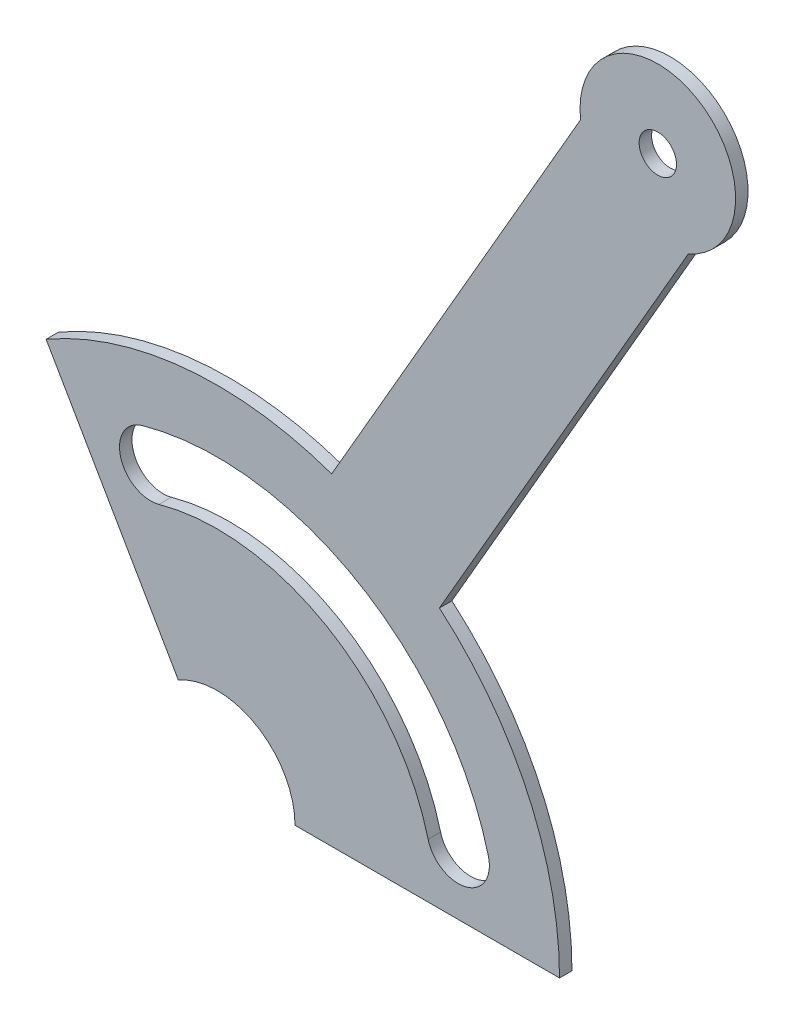
from build123d import *

# Parameters (mm, degrees)
BASE_FLANGE1_DEPTH = 2
CUT_EXTRUDE1_DEPTH = 10
SKETCH9_R          = 3
CUT_EXTRUDE2_DEPTH = 10


# Sheet-metal steps are written as plain solids
with BuildPart() as part:
    # Sketch1 → Base-Flange1 (new body)
    with BuildSketch(Plane.XY):
        with BuildLine():
            Line((12.5, 0), (55, 0))
            ThreePointArc((55, 0), (49.942986861, 23.036884846), (35.701888604, 41.837484988))
            Line((35.701888604, 41.837484988), (75.701888604, 111.119517291))
            ThreePointArc((75.701888604, 111.119517291), (77.041634566, 133.440025366), (58.381380528, 121.119517291))
            Line((58.381380528, 121.119517291), (18.381380528, 51.837484988))
            ThreePointArc((18.381380528, 51.837484988), (-5.02096593, 54.770337785), (-27.5, 47.631397208))
            Line((-27.5, 47.631397208), (-6.25, 10.825317547))
            ThreePointArc((-6.25, 10.825317547), (6.25, 10.825317547), (12.5, 0))
        make_face()
    extrude(amount=-BASE_FLANGE1_DEPTH)

    # Sketch6 → Cut-Extrude1 (cut)
    with BuildSketch(Plane(origin=(0, 0, -2), x_dir=(-1, 0, 0), z_dir=(0, 0, -1))):
        with BuildLine():
            ThreePointArc((12.04274553, 43.35864712), (-22.5, 38.97114317), (-43.571062645, 11.25))
            ThreePointArc((-43.571062645, 11.25), (-39.979833462, 5.158770817), (-33.888604279, 8.75))
            ThreePointArc((-33.888604279, 8.75), (-17.5, 30.310889132), (9.366579857, 33.723392205))
            ThreePointArc((9.366579857, 33.723392205), (15.522290151, 37.202936826), (12.04274553, 43.35864712))
        make_face()
    extrude(amount=-CUT_EXTRUDE1_DEPTH, mode=Mode.SUBTRACT)

    # Sketch9 → Cut-Extrude2 (cut)
    with BuildSketch(Plane(origin=(0, 0, -2), x_dir=(-1, 0, 0), z_dir=(0, 0, -1))):
        with Locations((-70.791634566, 122.614707819)):
            Circle(SKETCH9_R)
    extrude(amount=-CUT_EXTRUDE2_DEPTH, mode=Mode.SUBTRACT)


solid = part.part
